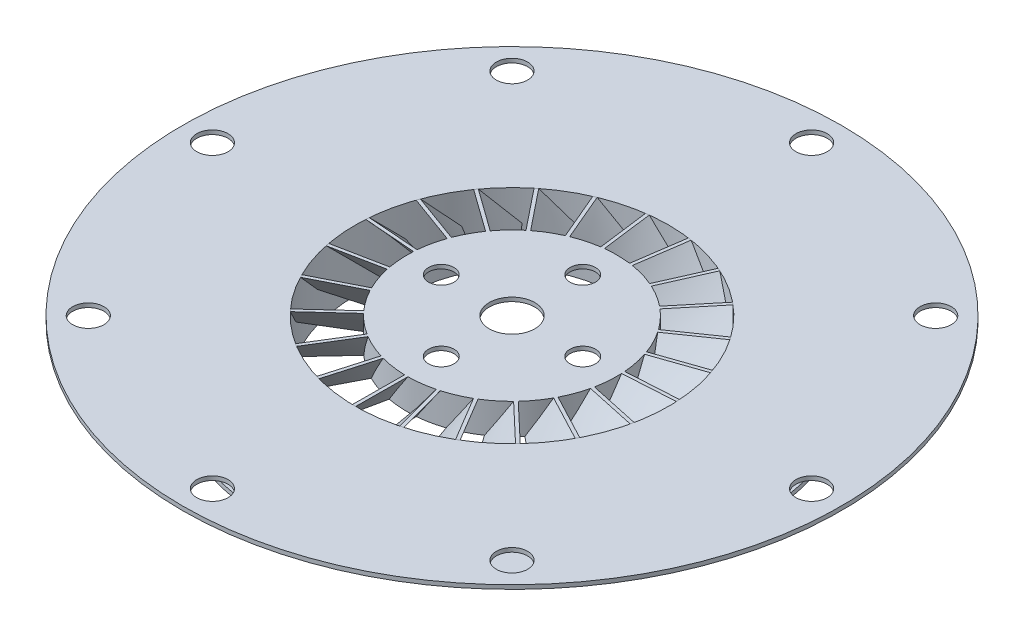
from build123d import *

# Parameters (mm, degrees)
SKETCH1_R                              = 34.0882
SKETCH1_R_2                            = 33.25
BOSS_EXTRUDE1_DEPTH                    = 6.5
SKETCH1_3_R                            = 69.85
SKETCH1_3_R_2                          = 34.0882
BOSS_EXTRUDE2_DEPTH                    = 0.8636
SKETCH1_4_R                            = 22.25
SKETCH1_4_R_2                          = 21.4118
BOSS_EXTRUDE3_DEPTH                    = 6.5
SKETCH1_5_R                            = 21.4118
BOSS_EXTRUDE4_DEPTH                    = 0.7
CIRPATTERN1_COUNT                      = 23
SKETCH4_R                              = 21.55
BOSS_EXTRUDE5_DEPTH                    = 0.8382
CBORE_FOR_M5_HEX_HEAD_BOLT1_AT_2_COUNT = 2
CBORE_FOR_M5_HEX_HEAD_BOLT1_AT_2_PITCH = 21.205976804
CBORE_FOR_M5_HEX_HEAD_BOLT1_AT_3_COUNT = 2
CBORE_FOR_M5_HEX_HEAD_BOLT1_AT_3_PITCH = 29.98978
CBORE_FOR_M5_HEX_HEAD_BOLT1_AT_4_COUNT = 2
CBORE_FOR_M5_HEX_HEAD_BOLT1_AT_4_PITCH = 21.205976804
SKETCH8_R                              = 21.39
CUT_EXTRUDE1_DEPTH                     = 1.5
SKETCH8_2_R                            = 22.25
SKETCH8_2_R_2                          = 21.39
BOSS_EXTRUDE6_DEPTH                    = 6.5
SKETCH9_R                              = 4.826
CUT_EXTRUDE3_DEPTH                     = 2.54
SKETCH10_R                             = 3.3147
CUT_EXTRUDE4_DEPTH                     = 10
CIRPATTERN2_COUNT                      = 8
SKETCH11_R                             = 3.3147
CUT_EXTRUDE5_DEPTH                     = 10
CIRPATTERN3_COUNT                      = 6
SKETCH12_R                             = 69.85
SKETCH12_R_2                           = 3.3147
SKETCH12_R_3                           = 34.0882
BOSS_EXTRUDE9_DEPTH                    = 5.6364
CUT_EXTRUDE7_START                     = -0.8636
CUT_EXTRUDE7_OUTLINE_R                 = 69.85
CUT_EXTRUDE7_OUTLINE_R_2               = 3.3147
CUT_EXTRUDE7_OUTLINE_R_3               = 34.0882
CUT_EXTRUDE7_DEPTH                     = 5.6364
BOSS_EXTRUDE10_START                   = 6.5
SKETCH13_R                             = 34.0882
SKETCH13_R_2                           = 33.25
BOSS_EXTRUDE10_DEPTH                   = 6.5
BOSS_EXTRUDE11_START                   = -0.8636
SKETCH15_R                             = 3.3147
BOSS_EXTRUDE11_DEPTH                   = 0.8636
SKETCH16_R                             = 50.8
SKETCH16_R_2                           = 3.3147
SKETCH16_R_3                           = 34.0882
BOSS_EXTRUDE12_DEPTH                   = 0.8636


# Read off the part's stored shape, not the designer's step: Cut-Extrude7
with BuildPart() as part:
    # Sketch1 → Boss-Extrude1 (new body)
    with BuildSketch(Plane(origin=(0, 0, 0), x_dir=(1, 0, 0), z_dir=(0, 1, 0))):
        with Locations(Location((0, 0, 0), (0, 0, 90))):
            Circle(SKETCH1_R)
        with Locations(Location((0, 0, 0), (0, 0, 90))):
            Circle(SKETCH1_R_2, mode=Mode.SUBTRACT)
    extrude(amount=BOSS_EXTRUDE1_DEPTH)

    # Sketch1<3> → Boss-Extrude2 (add)
    with BuildSketch(Plane(origin=(0, 0, 0), x_dir=(1, 0, 0), z_dir=(0, 1, 0))):
        with Locations(Location((0, 0, 0), (0, 0, 270))):
            Circle(SKETCH1_3_R)
        with Locations(Location((0, 0, 0), (0, 0, 90))):
            Circle(SKETCH1_3_R_2, mode=Mode.SUBTRACT)
    extrude(amount=BOSS_EXTRUDE2_DEPTH)

    # Sketch10 → Cut-Extrude4 (cut)
    with BuildSketch(Plane.XZ):
        with Locations(Location((0, 63.5, 0), (0, 0, 270))):
            Circle(SKETCH10_R)
    cut_extrude4 = extrude(amount=-CUT_EXTRUDE4_DEPTH, mode=Mode.SUBTRACT)

    # CirPattern2: Cut-Extrude4 ×8 about axis
    cirpattern2_axis = Axis((0, 0, 0), (0, 1, 0))
    for i in range(1, CIRPATTERN2_COUNT):
        add(cut_extrude4.rotate(cirpattern2_axis, i * 360 / CIRPATTERN2_COUNT), mode=Mode.SUBTRACT)

    # Sketch11 → Cut-Extrude5 (cut)
    with BuildSketch(Plane.XZ):
        with Locations(Location((0, 44.45, 0), (0, 0, 270))):
            Circle(SKETCH11_R)
    cut_extrude5 = extrude(amount=-CUT_EXTRUDE5_DEPTH, mode=Mode.SUBTRACT)

    # CirPattern3: Cut-Extrude5 ×6 about axis
    cirpattern3_axis = Axis((0, 0, 0), (0, 1, 0))
    for i in range(1, CIRPATTERN3_COUNT):
        add(cut_extrude5.rotate(cirpattern3_axis, i * 360 / CIRPATTERN3_COUNT), mode=Mode.SUBTRACT)

    # Sketch12 → Boss-Extrude9 (add)
    with BuildSketch(Plane(origin=(0, 0.8636, 0), x_dir=(1, 0, 0), z_dir=(0, 1, 0))):
        with Locations(Location((0, 0, 0), (0, 0, 270))):
            Circle(SKETCH12_R)
        with Locations(Location((38.494829198, 22.225, 0), (0, 0, 210))):
            Circle(SKETCH12_R_2, mode=Mode.SUBTRACT)
        with Locations(Location((-38.494829198, 22.225, 0), (0, 0, 330))):
            Circle(SKETCH12_R_2, mode=Mode.SUBTRACT)
        with Locations(Location((0, -44.45, 0), (0, 0, 90))):
            Circle(SKETCH12_R_2, mode=Mode.SUBTRACT)
        with Locations(Location((-44.901280605, 44.901280605, 0), (0, 0, 315))):
            Circle(SKETCH12_R_2, mode=Mode.SUBTRACT)
        with Locations(Location((44.901280605, 44.901280605, 0), (0, 0, 225))):
            Circle(SKETCH12_R_2, mode=Mode.SUBTRACT)
        with Locations(Location((44.901280605, -44.901280605, 0), (0, 0, 135))):
            Circle(SKETCH12_R_2, mode=Mode.SUBTRACT)
        with Locations(Location((0, -63.5, 0), (0, 0, 90))):
            Circle(SKETCH12_R_2, mode=Mode.SUBTRACT)
        Circle(SKETCH12_R_3, mode=Mode.SUBTRACT)
        with Locations(Location((-44.901280605, -44.901280605, 0), (0, 0, 45))):
            Circle(SKETCH12_R_2, mode=Mode.SUBTRACT)
        with Locations(Location((63.5, 0, 0), (0, 0, 180))):
            Circle(SKETCH12_R_2, mode=Mode.SUBTRACT)
        with Locations(Location((0, 63.5, 0), (0, 0, 270))):
            Circle(SKETCH12_R_2, mode=Mode.SUBTRACT)
        with Locations((-63.5, 0)):
            Circle(SKETCH12_R_2, mode=Mode.SUBTRACT)
        with Locations(Location((-38.494829198, -22.225, 0), (0, 0, 30))):
            Circle(SKETCH12_R_2, mode=Mode.SUBTRACT)
        with Locations(Location((0, 44.45, 0), (0, 0, 270))):
            Circle(SKETCH12_R_2, mode=Mode.SUBTRACT)
        with Locations(Location((38.494829198, -22.225, 0), (0, 0, 150))):
            Circle(SKETCH12_R_2, mode=Mode.SUBTRACT)
    extrude(amount=BOSS_EXTRUDE9_DEPTH)

    # Cut-Extrude7 outline → Cut-Extrude7 (cut)
    with BuildSketch(Plane(origin=(0, 0.8636, 0), x_dir=(1, 0, 0), z_dir=(0, 1, 0)).offset(CUT_EXTRUDE7_START)):
        Circle(CUT_EXTRUDE7_OUTLINE_R)
        with Locations((-44.901280605, -44.901280605)):
            Circle(CUT_EXTRUDE7_OUTLINE_R_2, mode=Mode.SUBTRACT)
        with Locations((-38.494829198, -22.225)):
            Circle(CUT_EXTRUDE7_OUTLINE_R_2, mode=Mode.SUBTRACT)
        with Locations((0, -63.5)):
            Circle(CUT_EXTRUDE7_OUTLINE_R_2, mode=Mode.SUBTRACT)
        with Locations((0, -44.45)):
            Circle(CUT_EXTRUDE7_OUTLINE_R_2, mode=Mode.SUBTRACT)
        with Locations((44.901280605, -44.901280605)):
            Circle(CUT_EXTRUDE7_OUTLINE_R_2, mode=Mode.SUBTRACT)
        with Locations((38.494829198, -22.225)):
            Circle(CUT_EXTRUDE7_OUTLINE_R_2, mode=Mode.SUBTRACT)
        with Locations((-63.5, 0)):
            Circle(CUT_EXTRUDE7_OUTLINE_R_2, mode=Mode.SUBTRACT)
        with Locations((-38.494829198, 22.225)):
            Circle(CUT_EXTRUDE7_OUTLINE_R_2, mode=Mode.SUBTRACT)
        with Locations((-44.901280605, 44.901280605)):
            Circle(CUT_EXTRUDE7_OUTLINE_R_2, mode=Mode.SUBTRACT)
        Circle(CUT_EXTRUDE7_OUTLINE_R_3, mode=Mode.SUBTRACT)
        with Locations((63.5, 0)):
            Circle(CUT_EXTRUDE7_OUTLINE_R_2, mode=Mode.SUBTRACT)
        with Locations((38.494829198, 22.225)):
            Circle(CUT_EXTRUDE7_OUTLINE_R_2, mode=Mode.SUBTRACT)
        with Locations((0, 44.45)):
            Circle(CUT_EXTRUDE7_OUTLINE_R_2, mode=Mode.SUBTRACT)
        with Locations((0, 63.5)):
            Circle(CUT_EXTRUDE7_OUTLINE_R_2, mode=Mode.SUBTRACT)
        with Locations((44.901280605, 44.901280605)):
            Circle(CUT_EXTRUDE7_OUTLINE_R_2, mode=Mode.SUBTRACT)
    extrude(amount=CUT_EXTRUDE7_DEPTH, mode=Mode.SUBTRACT)

    # Sketch13 → Boss-Extrude10 (add)
    with BuildSketch(Plane.XZ.offset(BOSS_EXTRUDE10_START)):
        with Locations(Location((0, 0, 0), (0, 0, 90))):
            Circle(SKETCH13_R)
        with Locations(Location((0, 0, 0), (0, 0, 270))):
            Circle(SKETCH13_R_2, mode=Mode.SUBTRACT)
    extrude(amount=-BOSS_EXTRUDE10_DEPTH)

    # Sketch15 → Boss-Extrude11 (add)
    with BuildSketch(Plane(origin=(0, 6.5, 0), x_dir=(1, 0, 0), z_dir=(0, 1, 0)).offset(BOSS_EXTRUDE11_START)):
        with Locations((-38.494829198, 22.225)):
            Circle(SKETCH15_R)
        with Locations((-38.494829198, -22.225)):
            Circle(SKETCH15_R)
        with Locations((0, -44.45)):
            Circle(SKETCH15_R)
        with Locations((38.494829198, -22.225)):
            Circle(SKETCH15_R)
        with Locations((38.494829198, 22.225)):
            Circle(SKETCH15_R)
        with Locations((0, 44.45)):
            Circle(SKETCH15_R)
    extrude(amount=BOSS_EXTRUDE11_DEPTH)

    # Sketch16 → Boss-Extrude12 (add)
    with BuildSketch(Plane.XZ.offset(6.5)):
        with Locations(Location((0, 0, 0), (0, 0, 270))):
            Circle(SKETCH16_R)
        with Locations(Location((38.494829198, -22.225, 0), (0, 0, 270))):
            Circle(SKETCH16_R_2, mode=Mode.SUBTRACT)
        with Locations(Location((0, -44.45, 0), (0, 0, 270))):
            Circle(SKETCH16_R_2, mode=Mode.SUBTRACT)
        with Locations(Location((-38.494829198, -22.225, 0), (0, 0, 270))):
            Circle(SKETCH16_R_2, mode=Mode.SUBTRACT)
        with Locations(Location((-38.494829198, 22.225, 0), (0, 0, 270))):
            Circle(SKETCH16_R_2, mode=Mode.SUBTRACT)
        with Locations(Location((0, 44.45, 0), (0, 0, 270))):
            Circle(SKETCH16_R_2, mode=Mode.SUBTRACT)
        with Locations(Location((38.494829198, 22.225, 0), (0, 0, 270))):
            Circle(SKETCH16_R_2, mode=Mode.SUBTRACT)
        with Locations(Location((0, 0, 0), (0, 0, 90))):
            Circle(SKETCH16_R_3, mode=Mode.SUBTRACT)
    extrude(amount=-BOSS_EXTRUDE12_DEPTH)


with BuildPart() as body_2:
    # Sketch1<4> → Boss-Extrude3 (new body)
    with BuildSketch(Plane(origin=(0, 0, 0), x_dir=(1, 0, 0), z_dir=(0, 1, 0))):
        with Locations(Location((0, 0, 0), (0, 0, 90))):
            Circle(SKETCH1_4_R)
        with Locations(Location((0, 0, 0), (0, 0, 90))):
            Circle(SKETCH1_4_R_2, mode=Mode.SUBTRACT)
    extrude(amount=BOSS_EXTRUDE3_DEPTH)

    # Sketch1<5> → Boss-Extrude4 (add)
    with BuildSketch(Plane(origin=(0, 0, 0), x_dir=(1, 0, 0), z_dir=(0, 1, 0))):
        with Locations(Location((0, 0, 0), (0, 0, 90))):
            Circle(SKETCH1_5_R)
    extrude(amount=BOSS_EXTRUDE4_DEPTH)

    # Sketch2 → Loft1 section 0
    with BuildSketch(Plane.XZ):
        with BuildLine():
            Line((-31.92079709, 9.307266684), (-21.327829882, 6.339256464))
            ThreePointArc((-21.327829882, 6.339256464), (-21.424909643, 6.002978158), (-21.516687622, 5.665214363))
            Line((-21.516687622, 5.665214363), (-32.10965483, 8.633224583))
            ThreePointArc((-32.10965483, 8.633224583), (-32.016999804, 8.970742641), (-31.92079709, 9.307266684))
        make_face()
    # Sketch3 → Loft1 section 1
    with BuildSketch(Plane(origin=(0, 6.5, 0), x_dir=(1, 0, 0), z_dir=(0, 1, 0))):
        with BuildLine():
            Line((-19.989502375, -9.771504224), (-29.795551138, -14.757629633))
            ThreePointArc((-29.795551138, -14.757629633), (-29.638556899, -15.070449394), (-29.478278519, -15.381599252))
            Line((-29.478278519, -15.381599252), (-19.672229756, -10.395473843))
            ThreePointArc((-19.672229756, -10.395473843), (-19.83332003, -10.084736812), (-19.989502375, -9.771504224))
        make_face()
    loft1 = loft()

    # CirPattern1: Loft1 ×23 about axis
    cirpattern1_axis = Axis((0, 6.5, 0), (0, -1, 0))
    for i in range(1, CIRPATTERN1_COUNT):
        add(loft1.rotate(cirpattern1_axis, i * 360 / CIRPATTERN1_COUNT))

    # Sketch4 → Boss-Extrude5 (add)
    with BuildSketch(Plane(origin=(0, 6.5, 0), x_dir=(1, 0, 0), z_dir=(0, 1, 0))):
        Circle(SKETCH4_R)
    extrude(amount=-BOSS_EXTRUDE5_DEPTH)

    # Sketch7 → CBORE for M5 Hex Head Bolt1 (revolve, cut)
    with BuildSketch(Plane(origin=(0, 0, 14.99489), x_dir=(0, 0, -1), z_dir=(1, 0, 0))):
        Polygon((0, 0), (0, 6.5001), (2.7, 6.5001), (2.7, 3.58), (6.12, 3.58), (6.12, 0), align=None)
    cbore_for_m5_hex_head_bolt1 = revolve(axis=Axis((0, -6.35, 14.99489), (0, 1, 0)), mode=Mode.SUBTRACT)

    # CBORE for M5 Hex Head Bolt1 at 2: CBORE for M5 Hex Head Bolt1 ×2
    with Locations(*[Vector(0.7071067811865476, 0, -0.7071067811865476) * (i * CBORE_FOR_M5_HEX_HEAD_BOLT1_AT_2_PITCH) for i in range(1, CBORE_FOR_M5_HEX_HEAD_BOLT1_AT_2_COUNT)]):
        add(cbore_for_m5_hex_head_bolt1, mode=Mode.SUBTRACT)

    # CBORE for M5 Hex Head Bolt1 at 3: CBORE for M5 Hex Head Bolt1 ×2
    with Locations(*[(0, 0, -i * CBORE_FOR_M5_HEX_HEAD_BOLT1_AT_3_PITCH) for i in range(1, CBORE_FOR_M5_HEX_HEAD_BOLT1_AT_3_COUNT)]):
        add(cbore_for_m5_hex_head_bolt1, mode=Mode.SUBTRACT)

    # CBORE for M5 Hex Head Bolt1 at 4: CBORE for M5 Hex Head Bolt1 ×2
    with Locations(*[Vector(-0.7071067811865475, 0, -0.7071067811865477) * (i * CBORE_FOR_M5_HEX_HEAD_BOLT1_AT_4_PITCH) for i in range(1, CBORE_FOR_M5_HEX_HEAD_BOLT1_AT_4_COUNT)]):
        add(cbore_for_m5_hex_head_bolt1, mode=Mode.SUBTRACT)

    # Sketch8 → Cut-Extrude1 (cut)
    with BuildSketch(Plane.XZ):
        with Locations(Location((0, 0, 0), (0, 0, 270))):
            Circle(SKETCH8_R)
    extrude(amount=-CUT_EXTRUDE1_DEPTH, mode=Mode.SUBTRACT)

    # Sketch8<2> → Boss-Extrude6 (add)
    with BuildSketch(Plane.XZ):
        Circle(SKETCH8_2_R)
        with Locations(Location((0, 0, 0), (0, 0, 270))):
            Circle(SKETCH8_2_R_2, mode=Mode.SUBTRACT)
    extrude(amount=-BOSS_EXTRUDE6_DEPTH)

    # Sketch9 → Cut-Extrude3 (cut)
    with BuildSketch(Plane.XZ.offset(-5.6618)):
        with Locations(Location((0, 0, 0), (0, 0, 270))):
            Circle(SKETCH9_R)
    extrude(amount=-CUT_EXTRUDE3_DEPTH, mode=Mode.SUBTRACT)


solid = Compound([part.part, body_2.part])
